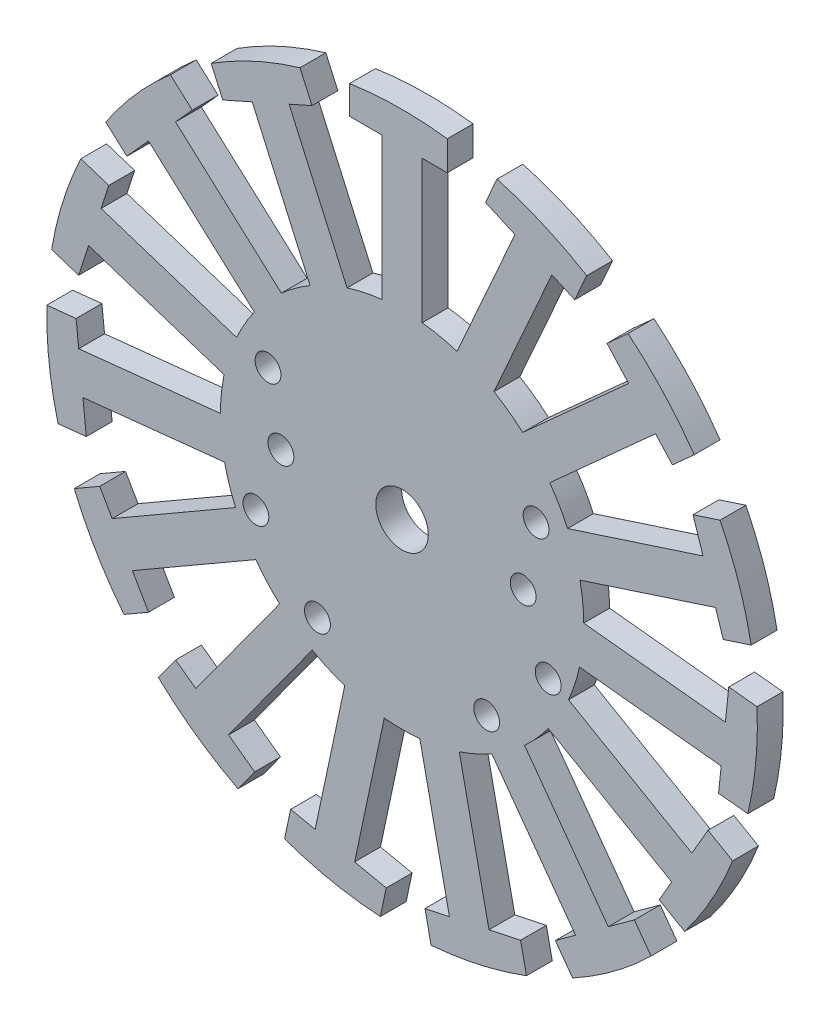
from build123d import *

# Parameters (mm, degrees)
EXTRUDE_2_DEPTH          = 3.2
PATTERN_CIRCULAR_2_COUNT = 15
SKETCH_3_R               = 3.25
CUT_EXTRUDE_2_DEPTH      = 3.2
SKETCH_5_R               = 1.6
CUT_EXTRUDE_3_DEPTH      = 10
SKETCH_6_R               = 1.6
CUT_EXTRUDE_4_DEPTH      = 10


with BuildPart() as part:
    # ｽｹｯﾁ1 → ﾎﾞｽ - 押し出し2 (new body)
    with BuildSketch(Plane.XY):
        with BuildLine():
            Line((2.5, 22.360679775), (2.5, 40))
            Line((2.5, 40), (5.6, 40))
            Line((5.6, 40), (5.6, 43.64218143))
            ThreePointArc((5.6, 43.64218143), (-0.454315658, 43.997654452), (-6.5, 43.517237964))
            Line((-6.5, 43.517237964), (-6.5, 40))
            Line((-6.5, 40), (-2.5, 40))
            Line((-2.5, 40), (-2.5, 22.360679775))
            ThreePointArc((-2.5, 22.360679775), (0, -22.5), (2.5, 22.360679775))
        make_face()
    extrude_2 = extrude(amount=EXTRUDE_2_DEPTH)

    # 円形ﾊﾟﾀｰﾝ2: ﾎﾞｽ - 押し出し2 ×15 about axis
    pattern_circular_2_axis = Axis((0, 0, 3.2), (0, 0, 1))
    for i in range(1, PATTERN_CIRCULAR_2_COUNT):
        add(extrude_2.rotate(pattern_circular_2_axis, i * 360 / PATTERN_CIRCULAR_2_COUNT))

    # ｽｹｯﾁ3 → ｶｯﾄ - 押し出し2 (cut)
    with BuildSketch(Plane.XY.offset(3.2)):
        Circle(SKETCH_3_R)
    extrude(amount=-CUT_EXTRUDE_2_DEPTH, mode=Mode.SUBTRACT)

    # ｽｹｯﾁ5 → ｶｯﾄ - 押し出し3 (cut)
    with BuildSketch(Plane.XY.offset(3.2)):
        with Locations((-15, 0)):
            Circle(SKETCH_5_R)
        with Locations((15, 0)):
            Circle(SKETCH_5_R)
        with Locations((10.4775, -15.75)):
            Circle(SKETCH_5_R)
        with Locations((-10.4775, -15.75)):
            Circle(SKETCH_5_R)
    extrude(amount=-CUT_EXTRUDE_3_DEPTH, mode=Mode.SUBTRACT)

    # ｽｹｯﾁ6 → ｶｯﾄ - 押し出し4 (cut)
    with BuildSketch(Plane.XY.offset(3.2)):
        with Locations((-16.6, 8)):
            Circle(SKETCH_6_R)
        with Locations((-18.1, -8)):
            Circle(SKETCH_6_R)
        with Locations((18.1, -8)):
            Circle(SKETCH_6_R)
        with Locations((16.6, 8)):
            Circle(SKETCH_6_R)
    extrude(amount=-CUT_EXTRUDE_4_DEPTH, mode=Mode.SUBTRACT)


solid = part.part
